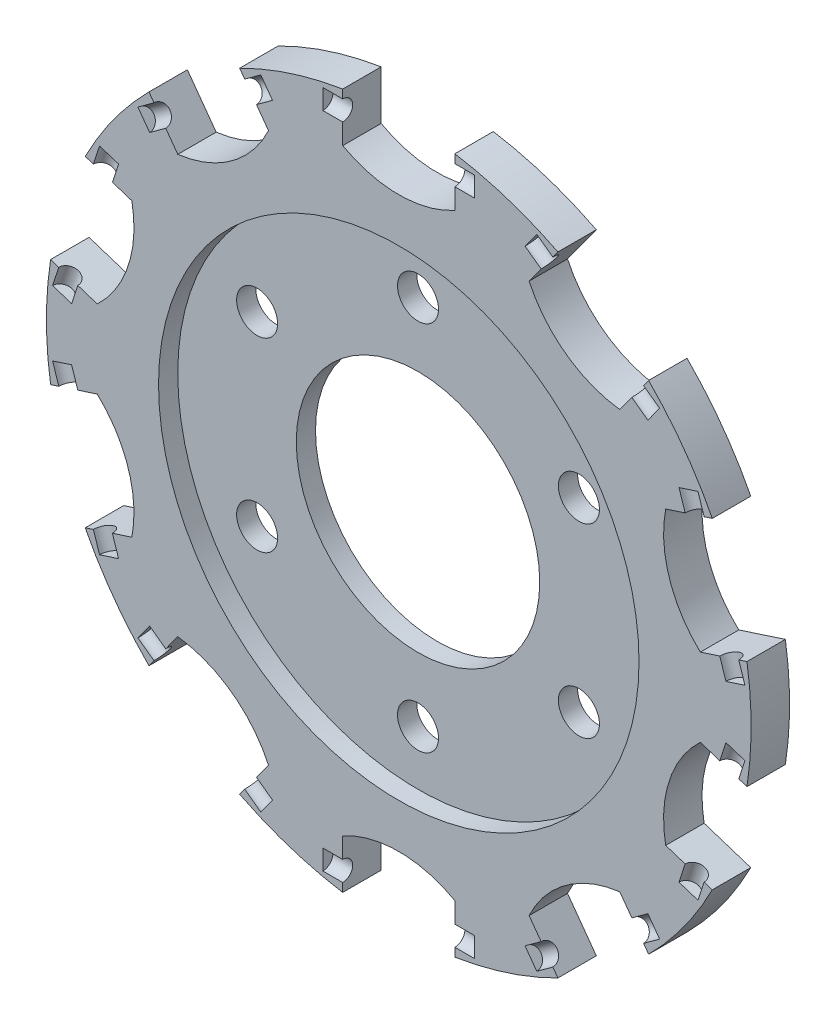
from build123d import *

# Parameters (mm, degrees)
SKETCH2_R           = 1.6
SKETCH2_R_2         = 9.5
BOSS_EXTRUDE2_DEPTH = 3
SKETCH2_4_R         = 18.75
SKETCH2_4_R_2       = 1.6
SKETCH2_4_R_3       = 9.5
BOSS_EXTRUDE3_DEPTH = 3
SKETCH3_W           = 11.85
SKETCH3_H           = 0.78
CIRPATTERN1_COUNT   = 10
SKETCH4_R           = 18.75
CUT_EXTRUDE4_DEPTH  = 1.5


with BuildPart() as part:
    # Sketch2 → Boss-Extrude2 (new body)
    with BuildSketch(Plane.XY):
        with BuildLine():
            Line((-4.375, 23.324003444), (-4.375, 27.149758286))
            ThreePointArc((-4.375, 27.149758286), (-8.497967345, 26.154054198), (-12.418778174, 24.536176326))
            Line((-12.418778174, 24.536176326), (-10.170055898, 21.441075642))
            ThreePointArc((-10.170055898, 21.441075642), (-13.044413657, 17.954095121), (-17.248954599, 16.297954684))
            Line((-17.248954599, 16.297954684), (-19.497676874, 19.393055368))
            ThreePointArc((-19.497676874, 19.393055368), (-22.247967345, 16.164094438), (-24.469005184, 12.550608962))
            Line((-24.469005184, 12.550608962), (-20.830496111, 11.3683857))
            ThreePointArc((-20.830496111, 11.3683857), (-21.106304661, 6.857854099), (-23.534394812, 3.046641182))
            Line((-23.534394812, 3.046641182), (-27.172903884, 4.228864445))
            ThreePointArc((-27.172903884, 4.228864445), (-27.5, 0), (-27.172903884, -4.228864445))
            Line((-27.172903884, -4.228864445), (-23.534394812, -3.046641182))
            ThreePointArc((-23.534394812, -3.046641182), (-21.106304661, -6.857854099), (-20.830496111, -11.3683857))
            Line((-20.830496111, -11.3683857), (-24.469005184, -12.550608962))
            ThreePointArc((-24.469005184, -12.550608962), (-22.247967345, -16.164094438), (-19.497676874, -19.393055368))
            Line((-19.497676874, -19.393055368), (-17.248954599, -16.297954684))
            ThreePointArc((-17.248954599, -16.297954684), (-13.044413657, -17.954095121), (-10.170055898, -21.441075642))
            Line((-10.170055898, -21.441075642), (-12.418778174, -24.536176326))
            ThreePointArc((-12.418778174, -24.536176326), (-8.497967345, -26.154054198), (-4.375, -27.149758286))
            Line((-4.375, -27.149758286), (-4.375, -23.324003444))
            ThreePointArc((-4.375, -23.324003444), (0, -22.192482044), (4.375, -23.324003444))
            Line((4.375, -23.324003444), (4.375, -27.149758286))
            ThreePointArc((4.375, -27.149758286), (8.497967345, -26.154054198), (12.418778174, -24.536176326))
            Line((12.418778174, -24.536176326), (10.170055898, -21.441075642))
            ThreePointArc((10.170055898, -21.441075642), (13.044413657, -17.954095121), (17.248954599, -16.297954684))
            Line((17.248954599, -16.297954684), (19.497676874, -19.393055368))
            ThreePointArc((19.497676874, -19.393055368), (22.247967345, -16.164094438), (24.469005184, -12.550608962))
            Line((24.469005184, -12.550608962), (20.830496111, -11.3683857))
            ThreePointArc((20.830496111, -11.3683857), (21.106304661, -6.857854099), (23.534394812, -3.046641182))
            Line((23.534394812, -3.046641182), (27.172903884, -4.228864445))
            ThreePointArc((27.172903884, -4.228864445), (27.5, 0), (27.172903884, 4.228864445))
            Line((27.172903884, 4.228864445), (23.534394812, 3.046641182))
            ThreePointArc((23.534394812, 3.046641182), (21.106304661, 6.857854099), (20.830496111, 11.3683857))
            Line((20.830496111, 11.3683857), (24.469005184, 12.550608962))
            ThreePointArc((24.469005184, 12.550608962), (22.247967345, 16.164094438), (19.497676874, 19.393055368))
            Line((19.497676874, 19.393055368), (17.248954599, 16.297954684))
            ThreePointArc((17.248954599, 16.297954684), (13.044413657, 17.954095121), (10.170055898, 21.441075642))
            Line((10.170055898, 21.441075642), (12.418778174, 24.536176326))
            ThreePointArc((12.418778174, 24.536176326), (8.497967345, 26.154054198), (4.375, 27.149758286))
            Line((4.375, 27.149758286), (4.375, 23.324003444))
            ThreePointArc((4.375, 23.324003444), (0, 22.192482044), (-4.375, 23.324003444))
        make_face()
        with Locations((0, 14.5)):
            Circle(SKETCH2_R, mode=Mode.SUBTRACT)
        with Locations((-12.557368355, -7.25)):
            Circle(SKETCH2_R, mode=Mode.SUBTRACT)
        with Locations((0, -14.5)):
            Circle(SKETCH2_R, mode=Mode.SUBTRACT)
        with Locations((12.557368355, -7.25)):
            Circle(SKETCH2_R, mode=Mode.SUBTRACT)
        with Locations((-12.557368355, 7.25)):
            Circle(SKETCH2_R, mode=Mode.SUBTRACT)
        Circle(SKETCH2_R_2, mode=Mode.SUBTRACT)
        with Locations((12.557368355, 7.25)):
            Circle(SKETCH2_R, mode=Mode.SUBTRACT)
    extrude(amount=BOSS_EXTRUDE2_DEPTH)

    # Sketch2<4> → Boss-Extrude3 (add)
    with BuildSketch(Plane.XY):
        Circle(SKETCH2_4_R)
        with Locations((-12.557368355, -7.25)):
            Circle(SKETCH2_4_R_2, mode=Mode.SUBTRACT)
        with Locations((0, -14.5)):
            Circle(SKETCH2_4_R_2, mode=Mode.SUBTRACT)
        with Locations((12.557368355, -7.25)):
            Circle(SKETCH2_4_R_2, mode=Mode.SUBTRACT)
        with Locations((-12.557368355, 7.25)):
            Circle(SKETCH2_4_R_2, mode=Mode.SUBTRACT)
        Circle(SKETCH2_4_R_3, mode=Mode.SUBTRACT)
        with Locations((12.557368355, 7.25)):
            Circle(SKETCH2_4_R_2, mode=Mode.SUBTRACT)
        with Locations((0, 14.5)):
            Circle(SKETCH2_4_R_2, mode=Mode.SUBTRACT)
    extrude(amount=BOSS_EXTRUDE3_DEPTH)

    # Sketch3 → Cut-Revolve1 (revolve, cut)
    with BuildSketch(Plane.XY.offset(3)):
        with Locations((0, 26.09)):
            Rectangle(SKETCH3_W, SKETCH3_H)
    cut_revolve1 = revolve(axis=Axis((5.925, 25.7, 3), (-1, 0, 0)), mode=Mode.SUBTRACT)

    # CirPattern1: Cut-Revolve1 ×10 about axis
    cirpattern1_axis = Axis((0, 0, 0), (0, 0, 1))
    for i in range(1, CIRPATTERN1_COUNT):
        add(cut_revolve1.rotate(cirpattern1_axis, i * 360 / CIRPATTERN1_COUNT), mode=Mode.SUBTRACT)

    # Sketch4 → Cut-Extrude4 (cut)
    with BuildSketch(Plane.XY.offset(3)):
        Circle(SKETCH4_R)
    extrude(amount=-CUT_EXTRUDE4_DEPTH, mode=Mode.SUBTRACT)


solid = part.part
